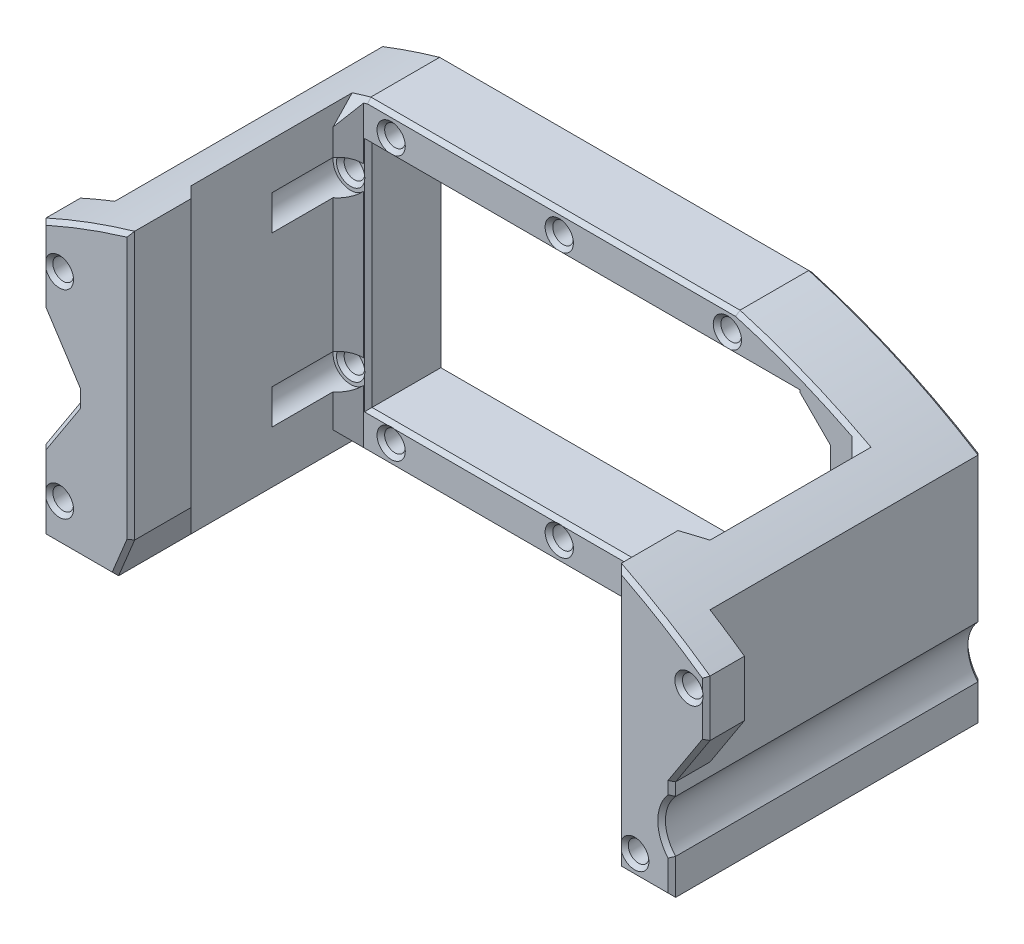
from build123d import *

# Parameters (mm, degrees)
SKETCH1_R                = 1.35
SKETCH1_W                = 56
SKETCH1_H                = 30
BOSS_EXTRUDE1_DEPTH      = 10
SKETCH2_W                = 5
SKETCH2_H                = 40.2
SKETCH2_H_2              = 35.1
BOSS_EXTRUDE2_DEPTH      = 27.57
BOSS_EXTRUDE3_DEPTH      = 3
BOSS_EXTRUDE3_DEPTH_BACK = 2
SKETCH3_R                = 1.35
SKETCH5_R                = 2.3
CUT_EXTRUDE2_DEPTH       = 10
CHAMFER4_SIZE            = 0.5
CUT_EXTRUDE3_DEPTH       = 40.57
CHAMFER6_SIZE            = 5
CHAMFER7_SIZE            = 4.545853152
CHAMFER7_SIZE_2          = 7
SKETCH7_R                = 5
CUT_EXTRUDE4_DEPTH       = 68.305088218
CHAMFER8_SIZE            = 4.545853152
CHAMFER8_SIZE_2          = 7
SKETCH9_R                = 2.35
CUT_EXTRUDE5_DEPTH       = 37.57
CHAMFER9_SIZE            = 0.5
CHAMFER10_SIZE           = 2
CUT_EXTRUDE6_DEPTH       = 6.825
CHAMFER11_SIZE           = 0.5


# Read off the part's stored shape, not the designer's step: Cut-Extrude3
with BuildPart() as part:
    # Sketch1 → Boss-Extrude1 (new body)
    with BuildSketch(Plane.XY):
        Polygon((33.5, 20.1), (45.3, 15), (45.3, -20.1), (-32.6, -20.1), (-32.6, 20.1), align=None)
        with Locations((22, 17.3)):
            Circle(SKETCH1_R, mode=Mode.SUBTRACT)
        with Locations((0, 17.3)):
            Circle(SKETCH1_R, mode=Mode.SUBTRACT)
        with Locations((-22, 17.3)):
            Circle(SKETCH1_R, mode=Mode.SUBTRACT)
        with Locations((-27.3, 11)):
            Circle(SKETCH1_R, mode=Mode.SUBTRACT)
        with Locations(Location((22, -17.3, 0), (0, 0, 180))):
            Circle(SKETCH1_R, mode=Mode.SUBTRACT)
        with Locations(Location((0, -17.3, 0), (0, 0, 180))):
            Circle(SKETCH1_R, mode=Mode.SUBTRACT)
        with Locations(Location((-22, -17.3, 0), (0, 0, 180))):
            Circle(SKETCH1_R, mode=Mode.SUBTRACT)
        with Locations(Location((-27.3, -11, 0), (0, 0, 180))):
            Circle(SKETCH1_R, mode=Mode.SUBTRACT)
        with Locations((3, 0)):
            Rectangle(SKETCH1_W, SKETCH1_H, mode=Mode.SUBTRACT)
    extrude(amount=BOSS_EXTRUDE1_DEPTH)

    # Sketch2 → Boss-Extrude2 (add)
    with BuildSketch(Plane.XY.offset(10)):
        with Locations((-30.1, 0)):
            Rectangle(SKETCH2_W, SKETCH2_H)
        with Locations((42.8, -2.55)):
            Rectangle(SKETCH2_W, SKETCH2_H_2)
    extrude(amount=BOSS_EXTRUDE2_DEPTH)

    # Sketch3 → Boss-Extrude3 (add, two sides: drawn at the far end of the back side and taken through both)
    # profile 1 of 2: a face of its own
    with BuildSketch(Plane.XY.offset(37.57).offset(-BOSS_EXTRUDE3_DEPTH_BACK)):
        Polygon((49.8, 0), (45.3, 0), (45.3, -20.1), (38.2, -20.1), (38.2, 15), (49.8, 15), align=None)
        with Locations((47.55, 5)):
            Circle(SKETCH3_R, mode=Mode.SUBTRACT)
        with Locations((40.45, -17.3)):
            Circle(SKETCH3_R, mode=Mode.SUBTRACT)
    # profile 2 of 2: a face of its own
    with BuildSketch(Plane.XY.offset(37.57).offset(-BOSS_EXTRUDE3_DEPTH_BACK)):
        Polygon((-25.5, 20.1), (-37.1, 20.1), (-37.1, 6), (-32.6, 6), (-32.6, -10), (-37.1, -10), (-37.1, -20.1), (-27.6, -20.1), (-25.5, -15), align=None)
        with Locations((-34.85, 11)):
            Circle(SKETCH3_R, mode=Mode.SUBTRACT)
        with Locations((-34.85, -15)):
            Circle(SKETCH3_R, mode=Mode.SUBTRACT)
    extrude(amount=BOSS_EXTRUDE3_DEPTH + BOSS_EXTRUDE3_DEPTH_BACK)

    # Sketch5 → Cut-Extrude2 (cut)
    with BuildSketch(Plane.XY.offset(10)):
        with Locations((-27.3, 11)):
            Circle(SKETCH5_R)
        with Locations((-27.3, -11)):
            Circle(SKETCH5_R)
    extrude(amount=CUT_EXTRUDE2_DEPTH, mode=Mode.SUBTRACT)

    # Chamfer4
    chamfer4_edges = [part.edges().sort_by_distance(p)[0] for p in [
        (42.8, 15, 10),
    ]]
    chamfer(chamfer4_edges, length=CHAMFER4_SIZE)

    # Cut-Extrude3 outline → Cut-Extrude3 (cut)
    with BuildSketch(Plane.XY):
        with BuildLine():
            Line((33.5, 20.1), (23.154502686, 20.1))
            ThreePointArc((23.154502686, 20.1), (37.024570378, 14.805977232), (49.8, 7.243315476))
            Line((49.8, 7.243315476), (49.8, 15))
            Line((49.8, 15), (45.3, 15))
            Line((45.3, 15), (33.5, 20.1))
        make_face()
        with BuildLine():
            ThreePointArc((-37.1, 15.705959627), (-31.207253619, 18.120471436), (-25.154502686, 20.1))
            Line((-25.154502686, 20.1), (-37.1, 20.1))
            Line((-37.1, 20.1), (-37.1, 15.705959627))
        make_face()
    extrude(amount=CUT_EXTRUDE3_DEPTH, mode=Mode.SUBTRACT)

    # Chamfer6
    # the kernel refuses this chamfer: 5 mm, written as the material it adds along each edge
    with BuildSketch(Plane(origin=(-27.6, 32.217217715, 35.57), x_dir=(-0.027495876610586317, 0, -0.9996219169112968), z_dir=(0, -1, 0))) as chamfer6_piece_1_section:
        Polygon((CHAMFER6_SIZE * 0.999621916911, CHAMFER6_SIZE * 0.0274958766106), (-CHAMFER6_SIZE * 0.0274958766106, CHAMFER6_SIZE * 0.999621916911), (0, 0), align=None)
    chamfer6_piece_1 = extrude(amount=52.317217715, mode=Mode.PRIVATE)
    chamfer6_piece_1 = chamfer6_piece_1 & Plane(origin=(-1.000000031, -63.999999922, 33.508943712), x_dir=(-0.4125714286119157, 0.9109252528572929, 0), z_dir=(0, 0, -1)) * Cylinder(87.499999916, 125, mode=Mode.PRIVATE)
    chamfer6_piece_1 = split(chamfer6_piece_1, bisect_by=Plane(origin=(-20.109291031, -1.908278217, 33.508943712), z_dir=(-0.9246780984747165, 0.38074980525429386, 0)), keep=Keep.TOP, mode=Mode.PRIVATE)
    chamfer6_piece_1 = split(chamfer6_piece_1, bisect_by=Plane(origin=(-25.5, 0.820013119, 33.508943712), z_dir=(-1, 0, 0)), keep=Keep.TOP, mode=Mode.PRIVATE)
    add(chamfer6_piece_1)
    with BuildSketch(Plane(origin=(40.3, -28.816774153, 35.57), x_dir=(0.027495876610586317, 0, -0.9996219169112968), z_dir=(0, 1, 0))) as chamfer6_piece_2_section:
        Polygon((CHAMFER6_SIZE * 0.999621916911, CHAMFER6_SIZE * 0.0274958766106), (-CHAMFER6_SIZE * 0.0274958766106, CHAMFER6_SIZE * 0.999621916911), (0, 0), align=None)
    chamfer6_piece_2 = extrude(amount=54.815062051, mode=Mode.PRIVATE)
    chamfer6_piece_2 = split(chamfer6_piece_2, bisect_by=Plane(origin=(39.385160208, -20.1, 33.537544361), z_dir=(0, 1, 0)), keep=Keep.TOP, mode=Mode.PRIVATE)
    chamfer6_piece_2 = chamfer6_piece_2 & Plane(origin=(-1.000000015, -64.000000032, 33.537544361), x_dir=(0.2760514593327394, 0.9611428571238851, 0), z_dir=(0, 0, -1)) * Cylinder(87.500000035, 130, mode=Mode.PRIVATE)
    chamfer6_piece_2 = chamfer6_piece_2 - Plane(origin=(40.45, -17.3, 33.537544361), x_dir=(1, 0, 0), z_dir=(0, 0, -1)) * Cylinder(1.35, 130, mode=Mode.PRIVATE)
    chamfer6_piece_2 = split(chamfer6_piece_2, bisect_by=Plane(origin=(38.2, -2.625807198, 33.537544361), z_dir=(1, 0, 0)), keep=Keep.TOP, mode=Mode.PRIVATE)
    add(chamfer6_piece_2)
    with BuildSketch(Plane(origin=(40.3, -20.1, 35.57), x_dir=(0.027495876610586317, 0, -0.9996219169112968), z_dir=(0, 1, 0))) as chamfer6_piece_3_section:
        Polygon((CHAMFER6_SIZE * 0.999621916911, CHAMFER6_SIZE * 0.0274958766106), (-CHAMFER6_SIZE * 0.0274958766106, CHAMFER6_SIZE * 0.999621916911), (0, 0), align=None)
    chamfer6_piece_3 = extrude(amount=14.316774153, mode=Mode.PRIVATE)
    chamfer6_piece_3 = chamfer6_piece_3 - Plane(origin=(40.45, -17.3, 33.551570137), x_dir=(1, 0, 0), z_dir=(0, 0, -1)) * Cylinder(1.35, 49, mode=Mode.PRIVATE)
    chamfer6_piece_3 = split(chamfer6_piece_3, bisect_by=Plane(origin=(38.2, -12.460180623, 33.551570137), z_dir=(1, 0, 0)), keep=Keep.TOP, mode=Mode.PRIVATE)
    add(chamfer6_piece_3)

    # Chamfer7
    # the kernel refuses this chamfer: 7, 4.545853152 mm, written as the material it adds along each edge
    with BuildSketch(Plane(origin=(45.3, 0, 35.57), x_dir=(0.9987532912567346, 0.049918565722988334, 0), z_dir=(0, 0, 1))) as chamfer7_piece_1_section:
        Polygon((CHAMFER7_SIZE * 0.998753291341, -CHAMFER7_SIZE * 0.0499185657272), (-CHAMFER7_SIZE_2 * 0.049918565723, -CHAMFER7_SIZE_2 * 0.998753291257), (0, 0), align=None)
    chamfer7_piece_1 = extrude(amount=5, mode=Mode.PRIVATE)
    chamfer7_piece_1 = split(chamfer7_piece_1, bisect_by=Plane(origin=(49.8, -2.345805882, 38.07), z_dir=(-1, 0, 0)), keep=Keep.TOP, mode=Mode.PRIVATE)
    add(chamfer7_piece_1)

    # Sketch7 → Cut-Extrude4 (cut, through all)
    with BuildSketch(Plane(origin=(0, 0, 0), x_dir=(-1, 0, 0), z_dir=(0, 0, -1))):
        with Locations((-48.97, -12.05)):
            Circle(SKETCH7_R)
    extrude(amount=-CUT_EXTRUDE4_DEPTH, mode=Mode.SUBTRACT)

    # Chamfer8
    # the kernel refuses this chamfer: 7, 4.545853152 mm, written as the material it adds along each edge
    with BuildSketch(Plane(origin=(-32.6, -10, 35.57), x_dir=(-0.9987532912567346, -0.04991856572298821, 0), z_dir=(0, 0, 1))) as chamfer8_piece_1_section:
        Polygon((CHAMFER8_SIZE * 0.998753291341, -CHAMFER8_SIZE * 0.0499185657272), (-CHAMFER8_SIZE_2 * 0.049918565723, -CHAMFER8_SIZE_2 * 0.998753291257), (0, 0), align=None)
    chamfer8_piece_1 = extrude(amount=5, mode=Mode.PRIVATE)
    chamfer8_piece_1 = split(chamfer8_piece_1, bisect_by=Plane(origin=(-37.1, -7.654194118, 38.07), z_dir=(1, 0, 0)), keep=Keep.TOP, mode=Mode.PRIVATE)
    add(chamfer8_piece_1)
    with BuildSketch(Plane(origin=(-32.6, 6, 40.57), x_dir=(-0.9987532912567346, 0.049918565722988396, 0), z_dir=(0, 0, -1))) as chamfer8_piece_2_section:
        Polygon((CHAMFER8_SIZE * 0.998753291341, -CHAMFER8_SIZE * 0.0499185657272), (-CHAMFER8_SIZE_2 * 0.049918565723, -CHAMFER8_SIZE_2 * 0.998753291257), (0, 0), align=None)
    chamfer8_piece_2 = extrude(amount=5, mode=Mode.PRIVATE)
    chamfer8_piece_2 = split(chamfer8_piece_2, bisect_by=Plane(origin=(-37.1, 3.654194118, 38.07), z_dir=(1, 0, 0)), keep=Keep.TOP, mode=Mode.PRIVATE)
    add(chamfer8_piece_2)

    # Sketch9 → Cut-Extrude5 (cut)
    with BuildSketch(Plane.XY):
        with Locations(Location((40.45, -17.3, 0), (0, 0, 196.774744264))):
            Circle(SKETCH9_R)
    extrude(amount=CUT_EXTRUDE5_DEPTH, mode=Mode.SUBTRACT)

    # Chamfer9
    # the kernel refuses this chamfer: 0.5 mm, written as the material it takes off along each edge
    with BuildSketch(Plane(origin=(-34.85, 11, 40.57), x_dir=(1, 0, 0), z_dir=(0, -1, 0))) as chamfer9_piece_1:
        Polygon((1.35, -CHAMFER9_SIZE), (1.35 + CHAMFER9_SIZE, 0), (1.35, 0), align=None)
    revolve(axis=Axis((-34.85, 11, 40.57), (0, 0, 1)), mode=Mode.SUBTRACT)
    with BuildSketch(Plane(origin=(-34.85, -15, 40.57), x_dir=(1, 0, 0), z_dir=(0, -1, 0))) as chamfer9_piece_2:
        Polygon((1.35, -CHAMFER9_SIZE), (1.35 + CHAMFER9_SIZE, 0), (1.35, 0), align=None)
    revolve(axis=Axis((-34.85, -15, 40.57), (0, 0, 1)), mode=Mode.SUBTRACT)
    with BuildSketch(Plane(origin=(-25.5, -16.285841494, 40.57), x_dir=(0.027495876610589196, 0, -0.9996219169112968), z_dir=(0, 1, 0))) as chamfer9_piece_3:
        Polygon((CHAMFER9_SIZE * 0.999621916911, CHAMFER9_SIZE * 0.0274958766106), (-CHAMFER9_SIZE * 0.0274958766106, CHAMFER9_SIZE * 0.999621916911), (0, 0), align=None)
    extrude(amount=37.571682988, mode=Mode.SUBTRACT)
    with BuildSketch(Plane(origin=(-37.1, -8.643550843, 40.57), x_dir=(-0.02749587661058229, 0, -0.9996219169112968), z_dir=(0, -1, 0))) as chamfer9_piece_4:
        Polygon((CHAMFER9_SIZE * 0.999621916911, CHAMFER9_SIZE * 0.0274958766106), (-CHAMFER9_SIZE * 0.0274958766106, CHAMFER9_SIZE * 0.999621916911), (0, 0), align=None)
    extrude(amount=12.742290651, mode=Mode.SUBTRACT)
    with BuildSketch(Plane(origin=(-38.385841494, -20.1, 40.57), x_dir=(0, -0.027495876610589196, -0.9996219169112968), z_dir=(1, 0, 0))) as chamfer9_piece_5:
        Polygon((CHAMFER9_SIZE * 0.999621916911, CHAMFER9_SIZE * 0.0274958766106), (-CHAMFER9_SIZE * 0.0274958766106, CHAMFER9_SIZE * 0.999621916911), (0, 0), align=None)
    extrude(amount=12.071682988, mode=Mode.SUBTRACT)
    with BuildSketch(Plane(origin=(-28.089583898, -21.288989468, 40.57), x_dir=(0.025424834900177554, -0.01046904966477896, -0.9996219169112965), z_dir=(0.38074980525429386, 0.9246780984747165, 0))) as chamfer9_piece_6:
        Polygon((CHAMFER9_SIZE * 0.999621916911, CHAMFER9_SIZE * 0.0274958766106), (-CHAMFER9_SIZE * 0.0274958766106, CHAMFER9_SIZE * 0.999621916911), (0, 0), align=None)
    extrude(amount=8.087115881, mode=Mode.SUBTRACT)
    with BuildSketch(Plane(origin=(47.55, 5, 35.57), x_dir=(1, 0, 0), z_dir=(0, -1, 0))) as chamfer9_piece_7:
        Polygon((1.35 + CHAMFER9_SIZE, 0), (1.35, CHAMFER9_SIZE), (1.35, 0), align=None)
    revolve(axis=Axis((47.55, 5, 35.57), (0, 0, 1)), mode=Mode.SUBTRACT)
    with BuildSketch(Plane(origin=(40.45, -17.3, 40.57), x_dir=(1, 0, 0), z_dir=(0, -1, 0))) as chamfer9_piece_8:
        Polygon((1.35, -CHAMFER9_SIZE), (1.35 + CHAMFER9_SIZE, 0), (1.35, 0), align=None)
    revolve(axis=Axis((40.45, -17.3, 40.57), (0, 0, 1)), mode=Mode.SUBTRACT)
    with BuildSketch(Plane(origin=(47.55, 5, 40.57), x_dir=(1, 0, 0), z_dir=(0, -1, 0))) as chamfer9_piece_9:
        Polygon((1.35, -CHAMFER9_SIZE), (1.35 + CHAMFER9_SIZE, 0), (1.35, 0), align=None)
    revolve(axis=Axis((47.55, 5, 40.57), (0, 0, 1)), mode=Mode.SUBTRACT)
    with BuildSketch(Plane(origin=(46.585841494, -20.1, 40.57), x_dir=(0, -0.027495876610589196, -0.9996219169112968), z_dir=(-1, 0, 0))) as chamfer9_piece_10:
        Polygon((CHAMFER9_SIZE * 0.999621916911, -CHAMFER9_SIZE * 0.0274958766106), (-CHAMFER9_SIZE * 0.0274958766106, -CHAMFER9_SIZE * 0.999621916911), (0, 0), align=None)
    extrude(amount=9.671682988, mode=Mode.SUBTRACT)
    with BuildSketch(Plane(origin=(45.3, -14.159905846, 40.57), x_dir=(0.02749587661058229, 0, -0.9996219169112968), z_dir=(0, -1, 0))) as chamfer9_piece_11:
        Polygon((CHAMFER9_SIZE * 0.999621916911, -CHAMFER9_SIZE * 0.0274958766106), (-CHAMFER9_SIZE * 0.0274958766106, -CHAMFER9_SIZE * 0.999621916911), (0, 0), align=None)
    extrude(amount=7.225935648, mode=Mode.SUBTRACT)
    with BuildSketch(Plane(origin=(49.8, -1.356449157, 40.57), x_dir=(0.02749587661058229, 0, -0.9996219169112968), z_dir=(0, 1, 0))) as chamfer9_piece_12:
        Polygon((CHAMFER9_SIZE * 0.999621916911, CHAMFER9_SIZE * 0.0274958766106), (-CHAMFER9_SIZE * 0.0274958766106, CHAMFER9_SIZE * 0.999621916911), (0, 0), align=None)
    extrude(amount=9.885606127, mode=Mode.SUBTRACT)
    with BuildSketch(Plane(origin=(-25, -15, 0), x_dir=(0, -0.9996219169112968, -0.02749587661058639), z_dir=(1, 0, 0)), Plane(origin=(31, 15, 0), x_dir=(0, 0.9996219169112968, -0.02749587661058639), z_dir=(-1, 0, 0)), Plane(origin=(-25, -15, 10), x_dir=(0, 0.027495876610585647, -0.9996219169112968), z_dir=(1, 0, 0)), Plane(origin=(31, 15, 10), x_dir=(0, -0.027495876610585647, -0.9996219169112968), z_dir=(-1, 0, 0))) as chamfer9_piece_13:
        Polygon((CHAMFER9_SIZE * 0.999621916911, -CHAMFER9_SIZE * 0.0274958766106), (-CHAMFER9_SIZE * 0.0274958766106, -CHAMFER9_SIZE * 0.999621916911), (0, 0), align=None)
    extrude(amount=56, mode=Mode.SUBTRACT)
    with BuildSketch(Plane(origin=(31, -15, 0), x_dir=(0.9996219169112968, 0, -0.027495876610586008), z_dir=(0, 1, 0)), Plane(origin=(-25, 15, 0), x_dir=(-0.9996219169112968, 0, -0.027495876610586292), z_dir=(0, -1, 0)), Plane(origin=(31, -15, 10), x_dir=(-0.0274958766105891, 0, -0.9996219169112968), z_dir=(0, 1, 0))) as chamfer9_piece_14:
        Polygon((CHAMFER9_SIZE * 0.999621916911, -CHAMFER9_SIZE * 0.0274958766106), (-CHAMFER9_SIZE * 0.0274958766106, -CHAMFER9_SIZE * 0.999621916911), (0, 0), align=None)
    extrude(amount=30, mode=Mode.SUBTRACT)
    with BuildSketch(Plane(origin=(-25, -15, 10), x_dir=(0.0274958766105891, 0, -0.9996219169112968), z_dir=(0, 1, 0))) as chamfer9_piece_15:
        Polygon((CHAMFER9_SIZE * 0.999621916911, CHAMFER9_SIZE * 0.0274958766106), (-CHAMFER9_SIZE * 0.0274958766106, CHAMFER9_SIZE * 0.999621916911), (0, 0), align=None)
    extrude(amount=30, mode=Mode.SUBTRACT)
    with BuildSketch(Plane(origin=(38.2, -21.385841494, 40.57), x_dir=(0.999621916911297, 0, 0.027495876610581914), z_dir=(0, 1, 0))) as chamfer9_piece_16:
        Polygon((CHAMFER9_SIZE * 0.999621916911, CHAMFER9_SIZE * 0.0274958766106), (-CHAMFER9_SIZE * 0.0274958766106, CHAMFER9_SIZE * 0.999621916911), (0, 0), align=None)
    extrude(amount=36.899619174, mode=Mode.SUBTRACT)
    with BuildSketch(Plane(origin=(-37.1, 16.991801121, 40.57), x_dir=(-0.02749587661058229, 0, -0.9996219169112968), z_dir=(0, -1, 0))) as chamfer9_piece_17:
        Polygon((CHAMFER9_SIZE * 0.999621916911, CHAMFER9_SIZE * 0.0274958766106), (-CHAMFER9_SIZE * 0.0274958766106, CHAMFER9_SIZE * 0.999621916911), (0, 0), align=None)
    extrude(amount=12.348250278, mode=Mode.SUBTRACT)
    with BuildSketch(Plane(origin=(-26.44034418, 20.1, 10), x_dir=(0, 0.0274958766105891, -0.9996219169112968), z_dir=(1, 0, 0)), Plane(origin=(-26.44034418, 20.1, 0), x_dir=(0, -0.9996219169112968, -0.027495876610586292), z_dir=(1, 0, 0))) as chamfer9_piece_18:
        Polygon((CHAMFER9_SIZE * 0.999621916911, -CHAMFER9_SIZE * 0.0274958766106), (-CHAMFER9_SIZE * 0.0274958766106, -CHAMFER9_SIZE * 0.999621916911), (0, 0), align=None)
    extrude(amount=50.88068836, mode=Mode.SUBTRACT)
    with BuildSketch(Plane(origin=(-32.6, -21.385841494, 0), x_dir=(0.9996219169112968, 0, -0.027495876610586483), z_dir=(0, 1, 0))) as chamfer9_piece_19:
        Polygon((CHAMFER9_SIZE * 0.999621916911, -CHAMFER9_SIZE * 0.0274958766106), (-CHAMFER9_SIZE * 0.0274958766106, -CHAMFER9_SIZE * 0.999621916911), (0, 0), align=None)
    extrude(amount=40.266351932, mode=Mode.SUBTRACT)
    with BuildSketch(Plane(origin=(-1.000000015, -64.000000032, 0), x_dir=(0.26189767014704823, 0.9650956483020467, 0), z_dir=(-0.9650956483020467, 0.26189767014704823, 0))) as chamfer9_piece_20:
        Polygon((87.500000035, -CHAMFER9_SIZE), (87.500000035 - CHAMFER9_SIZE, 0), (87.500000035, 0), align=None)
    revolve(axis=Axis((-1.000000015, -64.000000032, 0), (0, 0, -1)), revolution_arc=17.606857442, mode=Mode.SUBTRACT)
    with BuildSketch(Plane(origin=(-1.000000031, -63.999999922, 0), x_dir=(-0.37480693844731544, 0.9271028847392022, 0), z_dir=(-0.9271028847392022, -0.37480693844731544, 0))) as chamfer9_piece_21:
        Polygon((87.499999916, -CHAMFER9_SIZE), (87.499999916 - CHAMFER9_SIZE, 0), (87.499999916, 0), align=None)
    revolve(axis=Axis((-1.000000031, -63.999999922, 0), (0, 0, -1)), revolution_arc=6.829678471, mode=Mode.SUBTRACT)
    with BuildSketch(Plane(origin=(-1.000000031, -63.999999922, 40.57), x_dir=(-0.4259127914102548, 0.9047642201773481, 0), z_dir=(-0.9047642201773481, -0.4259127914102548, 0))) as chamfer9_piece_22:
        Polygon((87.499999916, CHAMFER9_SIZE), (87.499999916 - CHAMFER9_SIZE, 0), (87.499999916, 0), align=None)
    revolve(axis=Axis((-1.000000031, -63.999999922, 40.57), (0, 0, -1)), revolution_arc=9.790232324, mode=Mode.SUBTRACT)
    with BuildSketch(Plane(origin=(-1.000000015, -64.000000032, 10), x_dir=(0.2618977448025203, 0.9650956280428142, 0), z_dir=(-0.9650956280428142, 0.2618977448025203, 0))) as chamfer9_piece_23_section:
        Polygon((87.500000035, CHAMFER9_SIZE), (87.500000035 - CHAMFER9_SIZE, 0), (87.500000035, 0), align=None)
    chamfer9_piece_23 = revolve(axis=Axis((-1.000000015, -64.000000032, 10), (0, 0, -1)), revolution_arc=13.823488534, mode=Mode.PRIVATE)
    chamfer9_piece_23 = split(chamfer9_piece_23, bisect_by=Plane(origin=(40.3, 17.039811095, 9.759887498), z_dir=(-1, 0, 0)), keep=Keep.TOP, mode=Mode.PRIVATE)
    add(chamfer9_piece_23, mode=Mode.SUBTRACT)
    with BuildSketch(Plane(origin=(-1.000000031, -63.999999922, 10), x_dir=(-0.31796650495992856, 0.9481019469042177, 0), z_dir=(-0.9481019469042177, -0.31796650495992856, 0))) as chamfer9_piece_24_section:
        Polygon((87.499999916, CHAMFER9_SIZE), (87.499999916 - CHAMFER9_SIZE, 0), (87.499999916, 0), align=None)
    chamfer9_piece_24 = revolve(axis=Axis((-1.000000031, -63.999999922, 10), (0, 0, -1)), revolution_arc=3.357288735, mode=Mode.PRIVATE)
    chamfer9_piece_24 = split(chamfer9_piece_24, bisect_by=Plane(origin=(-27.6, 19.748899544, 9.835704297), z_dir=(1, 0, 0)), keep=Keep.TOP, mode=Mode.PRIVATE)
    add(chamfer9_piece_24, mode=Mode.SUBTRACT)
    with BuildSketch(Plane(origin=(-1.000000015, -64.000000032, 40.57), x_dir=(0.4348139292755294, 0.9005203200972064, 0), z_dir=(-0.9005203200972064, 0.4348139292755294, 0))) as chamfer9_piece_25:
        Polygon((87.500000035, CHAMFER9_SIZE), (87.500000035 - CHAMFER9_SIZE, 0), (87.500000035, 0), align=None)
    revolve(axis=Axis((-1.000000015, -64.000000032, 40.57), (0, 0, -1)), revolution_arc=10.559273171, mode=Mode.SUBTRACT)
    with BuildSketch(Plane(origin=(22, 17.3, 0), x_dir=(1, 0, 0), z_dir=(0, -1, 0))) as chamfer9_piece_26:
        Polygon((1.35 + CHAMFER9_SIZE, 0), (1.35, CHAMFER9_SIZE), (1.35, 0), align=None)
    revolve(axis=Axis((22, 17.3, 0), (0, 0, 1)), mode=Mode.SUBTRACT)
    with BuildSketch(Plane(origin=(22, 17.3, 10), x_dir=(1, 0, 0), z_dir=(0, -1, 0))) as chamfer9_piece_27:
        Polygon((1.35, -CHAMFER9_SIZE), (1.35 + CHAMFER9_SIZE, 0), (1.35, 0), align=None)
    revolve(axis=Axis((22, 17.3, 10), (0, 0, 1)), mode=Mode.SUBTRACT)
    with BuildSketch(Plane(origin=(50.50031947, 1.007789753, 40.57), x_dir=(0.023059982453161276, -0.0149753277040835, -0.9996219169112965), z_dir=(-0.5446390350150069, -0.8386705679454372, 0))) as chamfer9_piece_28_section:
        Polygon((CHAMFER9_SIZE * 0.999621916911, -CHAMFER9_SIZE * 0.0274958766106), (-CHAMFER9_SIZE * 0.0274958766106, -CHAMFER9_SIZE * 0.999621916911), (0, 0), align=None)
    chamfer9_piece_28 = extrude(amount=10.834036052, mode=Mode.PRIVATE)
    chamfer9_piece_28 = split(chamfer9_piece_28, bisect_by=Plane(origin=(45.3, -2.802949709, 40.40369704), z_dir=(1, 0, 0)), keep=Keep.TOP, mode=Mode.PRIVATE)
    add(chamfer9_piece_28, mode=Mode.SUBTRACT)
    with BuildSketch(Plane(origin=(45.3, -5.714158506, 40.57), x_dir=(0.02749587661058229, 0, -0.9996219169112968), z_dir=(0, -1, 0))) as chamfer9_piece_29_section:
        Polygon((CHAMFER9_SIZE * 0.999621916911, -CHAMFER9_SIZE * 0.0274958766106), (-CHAMFER9_SIZE * 0.0274958766106, -CHAMFER9_SIZE * 0.999621916911), (0, 0), align=None)
    chamfer9_piece_29 = extrude(amount=4.225935648, mode=Mode.PRIVATE)
    chamfer9_piece_29 = split(chamfer9_piece_29, bisect_by=Plane(origin=(44.52751756, -8.189518645, 40.400237862), z_dir=(0.8386705679454372, -0.5446390350150069, 0)), keep=Keep.TOP, mode=Mode.PRIVATE)
    add(chamfer9_piece_29, mode=Mode.SUBTRACT)
    with BuildSketch(Plane(origin=(45.3, 11.532457578, 0), x_dir=(0.027495876610582174, 0, 0.9996219169112968), z_dir=(0, -1, 0))) as chamfer9_piece_30:
        Polygon((CHAMFER9_SIZE * 0.999621916911, CHAMFER9_SIZE * 0.0274958766106), (-CHAMFER9_SIZE * 0.0274958766106, CHAMFER9_SIZE * 0.999621916911), (0, 0), align=None)
    extrude(amount=21.472551732, mode=Mode.SUBTRACT)
    with BuildSketch(Plane(origin=(48.97, -12.05, 40.57), x_dir=(-0.5370460782909577, -0.8435529087095265, 0), z_dir=(0.8435529087095265, -0.5370460782909577, 0))) as chamfer9_piece_31:
        Polygon((5, CHAMFER9_SIZE), (5 + CHAMFER9_SIZE, 0), (5, 0), align=None)
    revolve(axis=Axis((48.97, -12.05, 40.57), (0, 0, -1)), revolution_arc=115.03444382, mode=Mode.SUBTRACT)
    with BuildSketch(Plane(origin=(48.97, -12.05, 0), x_dir=(-0.5370460782909677, 0.84355290870952, 0), z_dir=(0.84355290870952, 0.5370460782909677, 0))) as chamfer9_piece_32:
        Polygon((5, CHAMFER9_SIZE), (5 + CHAMFER9_SIZE, 0), (5, 0), align=None)
    revolve(axis=Axis((48.97, -12.05, 0), (0, 0, 1)), revolution_arc=115.03444382, mode=Mode.SUBTRACT)
    with BuildSketch(Plane(origin=(-32.6, 0.285841494, 40.57), x_dir=(-0.02749587661058229, 0, -0.9996219169112968), z_dir=(0, -1, 0))) as chamfer9_piece_33_section:
        Polygon((CHAMFER9_SIZE * 0.999621916911, CHAMFER9_SIZE * 0.0274958766106), (-CHAMFER9_SIZE * 0.0274958766106, CHAMFER9_SIZE * 0.999621916911), (0, 0), align=None)
    chamfer9_piece_33 = extrude(amount=4.571682988, mode=Mode.PRIVATE)
    chamfer9_piece_33 = split(chamfer9_piece_33, bisect_by=Plane(origin=(-32.104033181, -1.763721927, 40.38758617), z_dir=(-0.8386705679454372, -0.5446390350150069, 0)), keep=Keep.TOP, mode=Mode.PRIVATE)
    chamfer9_piece_33 = split(chamfer9_piece_33, bisect_by=Plane(origin=(-32.104033181, -2.236278073, 40.38758617), z_dir=(-0.8386705679454372, 0.5446390350150069, 0)), keep=Keep.TOP, mode=Mode.PRIVATE)
    add(chamfer9_piece_33, mode=Mode.SUBTRACT)
    with BuildSketch(Plane(origin=(-37.80031947, -11.007789753, 40.57), x_dir=(-0.023059982453162067, 0.014975327704084013, -0.9996219169112965), z_dir=(0.5446390350150069, 0.8386705679454372, 0))) as chamfer9_piece_34_section:
        Polygon((CHAMFER9_SIZE * 0.999621916911, -CHAMFER9_SIZE * 0.0274958766106), (-CHAMFER9_SIZE * 0.0274958766106, -CHAMFER9_SIZE * 0.999621916911), (0, 0), align=None)
    chamfer9_piece_34 = extrude(amount=10.834036052, mode=Mode.PRIVATE)
    chamfer9_piece_34 = split(chamfer9_piece_34, bisect_by=Plane(origin=(-32.6, -7.197050291, 40.40369704), z_dir=(-1, 0, 0)), keep=Keep.TOP, mode=Mode.PRIVATE)
    add(chamfer9_piece_34, mode=Mode.SUBTRACT)
    with BuildSketch(Plane(origin=(0, 17.3, 0), x_dir=(1, 0, 0), z_dir=(0, -1, 0))) as chamfer9_piece_35:
        Polygon((1.35 + CHAMFER9_SIZE, 0), (1.35, CHAMFER9_SIZE), (1.35, 0), align=None)
    revolve(axis=Axis((0, 17.3, 0), (0, 0, 1)), mode=Mode.SUBTRACT)
    with BuildSketch(Plane(origin=(-37.80031947, 7.007789753, 40.57), x_dir=(-0.023059982453162854, -0.014975327704084525, -0.9996219169112965), z_dir=(0.5446390350150069, -0.8386705679454372, 0))) as chamfer9_piece_36_section:
        Polygon((CHAMFER9_SIZE * 0.999621916911, CHAMFER9_SIZE * 0.0274958766106), (-CHAMFER9_SIZE * 0.0274958766106, CHAMFER9_SIZE * 0.999621916911), (0, 0), align=None)
    chamfer9_piece_36 = extrude(amount=10.834036052, mode=Mode.PRIVATE)
    chamfer9_piece_36 = split(chamfer9_piece_36, bisect_by=Plane(origin=(-32.6, 3.197050291, 40.40369704), z_dir=(-1, 0, 0)), keep=Keep.TOP, mode=Mode.PRIVATE)
    add(chamfer9_piece_36, mode=Mode.SUBTRACT)
    with BuildSketch(Plane(origin=(0, 17.3, 10), x_dir=(1, 0, 0), z_dir=(0, -1, 0))) as chamfer9_piece_37:
        Polygon((1.35, -CHAMFER9_SIZE), (1.35 + CHAMFER9_SIZE, 0), (1.35, 0), align=None)
    revolve(axis=Axis((0, 17.3, 10), (0, 0, 1)), mode=Mode.SUBTRACT)
    with BuildSketch(Plane(origin=(40.45, -17.3, 0), x_dir=(-0.957446808511119, -0.2886097865143741, 0), z_dir=(-0.2886097865143741, 0.957446808511119, 0))) as chamfer9_piece_38:
        Polygon((2.35, CHAMFER9_SIZE), (2.35 + CHAMFER9_SIZE, 0), (2.35, 0), align=None)
    revolve(axis=Axis((40.45, -17.3, 0), (0, 0, 1)), mode=Mode.SUBTRACT)
    with BuildSketch(Plane(origin=(-22, 17.3, 0), x_dir=(1, 0, 0), z_dir=(0, -1, 0))) as chamfer9_piece_39:
        Polygon((1.35 + CHAMFER9_SIZE, 0), (1.35, CHAMFER9_SIZE), (1.35, 0), align=None)
    revolve(axis=Axis((-22, 17.3, 0), (0, 0, 1)), mode=Mode.SUBTRACT)
    with BuildSketch(Plane(origin=(-22, 17.3, 10), x_dir=(1, 0, 0), z_dir=(0, -1, 0))) as chamfer9_piece_40:
        Polygon((1.35, -CHAMFER9_SIZE), (1.35 + CHAMFER9_SIZE, 0), (1.35, 0), align=None)
    revolve(axis=Axis((-22, 17.3, 10), (0, 0, 1)), mode=Mode.SUBTRACT)
    with BuildSketch(Plane(origin=(-27.3, 11, 0), x_dir=(1, 0, 0), z_dir=(0, -1, 0))) as chamfer9_piece_41:
        Polygon((1.35 + CHAMFER9_SIZE, 0), (1.35, CHAMFER9_SIZE), (1.35, 0), align=None)
    revolve(axis=Axis((-27.3, 11, 0), (0, 0, 1)), mode=Mode.SUBTRACT)
    with BuildSketch(Plane(origin=(-27.3, 11, 10), x_dir=(1, 0, 0), z_dir=(0, 1, 0))) as chamfer9_piece_42:
        Polygon((1.35, CHAMFER9_SIZE), (1.35 + CHAMFER9_SIZE, 0), (1.35, 0), align=None)
    revolve(axis=Axis((-27.3, 11, 10), (0, 0, -1)), mode=Mode.SUBTRACT)
    with BuildSketch(Plane(origin=(22, -17.3, 0), x_dir=(-1, 0, 0), z_dir=(0, 1, 0))) as chamfer9_piece_43:
        Polygon((1.35 + CHAMFER9_SIZE, 0), (1.35, CHAMFER9_SIZE), (1.35, 0), align=None)
    revolve(axis=Axis((22, -17.3, 0), (0, 0, 1)), mode=Mode.SUBTRACT)
    with BuildSketch(Plane(origin=(22, -17.3, 10), x_dir=(-1, 0, 0), z_dir=(0, 1, 0))) as chamfer9_piece_44:
        Polygon((1.35, -CHAMFER9_SIZE), (1.35 + CHAMFER9_SIZE, 0), (1.35, 0), align=None)
    revolve(axis=Axis((22, -17.3, 10), (0, 0, 1)), mode=Mode.SUBTRACT)
    with BuildSketch(Plane(origin=(0, -17.3, 0), x_dir=(-1, 0, 0), z_dir=(0, 1, 0))) as chamfer9_piece_45:
        Polygon((1.35 + CHAMFER9_SIZE, 0), (1.35, CHAMFER9_SIZE), (1.35, 0), align=None)
    revolve(axis=Axis((0, -17.3, 0), (0, 0, 1)), mode=Mode.SUBTRACT)
    with BuildSketch(Plane(origin=(0, -17.3, 10), x_dir=(-1, 0, 0), z_dir=(0, 1, 0))) as chamfer9_piece_46:
        Polygon((1.35, -CHAMFER9_SIZE), (1.35 + CHAMFER9_SIZE, 0), (1.35, 0), align=None)
    revolve(axis=Axis((0, -17.3, 10), (0, 0, 1)), mode=Mode.SUBTRACT)
    with BuildSketch(Plane(origin=(-22, -17.3, 0), x_dir=(-1, 0, 0), z_dir=(0, 1, 0))) as chamfer9_piece_47:
        Polygon((1.35 + CHAMFER9_SIZE, 0), (1.35, CHAMFER9_SIZE), (1.35, 0), align=None)
    revolve(axis=Axis((-22, -17.3, 0), (0, 0, 1)), mode=Mode.SUBTRACT)
    with BuildSketch(Plane(origin=(-22, -17.3, 10), x_dir=(-1, 0, 0), z_dir=(0, 1, 0))) as chamfer9_piece_48:
        Polygon((1.35, -CHAMFER9_SIZE), (1.35 + CHAMFER9_SIZE, 0), (1.35, 0), align=None)
    revolve(axis=Axis((-22, -17.3, 10), (0, 0, 1)), mode=Mode.SUBTRACT)
    with BuildSketch(Plane(origin=(-27.3, -11, 0), x_dir=(-1, 0, 0), z_dir=(0, 1, 0))) as chamfer9_piece_49:
        Polygon((1.35 + CHAMFER9_SIZE, 0), (1.35, CHAMFER9_SIZE), (1.35, 0), align=None)
    revolve(axis=Axis((-27.3, -11, 0), (0, 0, 1)), mode=Mode.SUBTRACT)
    with BuildSketch(Plane(origin=(-27.3, -11, 10), x_dir=(-1, 0, 0), z_dir=(0, -1, 0))) as chamfer9_piece_50:
        Polygon((1.35, CHAMFER9_SIZE), (1.35 + CHAMFER9_SIZE, 0), (1.35, 0), align=None)
    revolve(axis=Axis((-27.3, -11, 10), (0, 0, -1)), mode=Mode.SUBTRACT)
    with BuildSketch(Plane(origin=(45.3, -14.159905846, 0), x_dir=(0.027495876610582174, 0, 0.9996219169112968), z_dir=(0, -1, 0))) as chamfer9_piece_51:
        Polygon((CHAMFER9_SIZE * 0.999621916911, CHAMFER9_SIZE * 0.0274958766106), (-CHAMFER9_SIZE * 0.0274958766106, CHAMFER9_SIZE * 0.999621916911), (0, 0), align=None)
    extrude(amount=7.225935648, mode=Mode.SUBTRACT)
    with BuildSketch(Plane(origin=(46.585841494, -20.1, 0), x_dir=(0, -0.02749587661058908, 0.9996219169112968), z_dir=(-1, 0, 0))) as chamfer9_piece_52:
        Polygon((CHAMFER9_SIZE * 0.999621916911, CHAMFER9_SIZE * 0.0274958766106), (-CHAMFER9_SIZE * 0.0274958766106, CHAMFER9_SIZE * 0.999621916911), (0, 0), align=None)
    extrude(amount=80.471682988, mode=Mode.SUBTRACT)
    with BuildSketch(Plane(origin=(40.3, -20.1, 10), x_dir=(0, -0.027495876610602904, -0.9996219169112963), z_dir=(-1, 0, 0))) as chamfer9_piece_53:
        Polygon((CHAMFER9_SIZE * 0.999621916911, -CHAMFER9_SIZE * 0.0274958766106), (-CHAMFER9_SIZE * 0.0274958766106, -CHAMFER9_SIZE * 0.999621916911), (0, 0), align=None)
    extrude(amount=67.9, mode=Mode.SUBTRACT)
    with BuildSketch(Plane(origin=(-34.85, -15, 35.57), x_dir=(1, 0, 0), z_dir=(0, -1, 0))) as chamfer9_piece_54:
        Polygon((1.35 + CHAMFER9_SIZE, 0), (1.35, CHAMFER9_SIZE), (1.35, 0), align=None)
    revolve(axis=Axis((-34.85, -15, 35.57), (0, 0, 1)), mode=Mode.SUBTRACT)
    with BuildSketch(Plane(origin=(-34.85, 11, 35.57), x_dir=(1, 0, 0), z_dir=(0, -1, 0))) as chamfer9_piece_55:
        Polygon((1.35 + CHAMFER9_SIZE, 0), (1.35, CHAMFER9_SIZE), (1.35, 0), align=None)
    revolve(axis=Axis((-34.85, 11, 35.57), (0, 0, 1)), mode=Mode.SUBTRACT)
    with BuildSketch(Plane(origin=(-25, 15, 0), x_dir=(-0.9996219169112968, 0, -0.027495876610586292), z_dir=(0, -1, 0))) as chamfer9_piece_56a_section:
        Polygon((CHAMFER9_SIZE * 0.999621916911, -CHAMFER9_SIZE * 0.0274958766106), (-CHAMFER9_SIZE * 0.0274958766106, -CHAMFER9_SIZE * 0.999621916911), (0, 0), align=None)
    chamfer9_piece_56a = extrude(amount=31.285841494, mode=Mode.PRIVATE)
    chamfer9_piece_56a = split(chamfer9_piece_56a, bisect_by=Plane(origin=(-25.164896813, -15, 0.164896813), z_dir=(0, -1, 0)), keep=Keep.TOP, mode=Mode.PRIVATE)
    with BuildSketch(Plane(origin=(-26.285841494, -15, 0), x_dir=(0, -0.9996219169112968, -0.02749587661058639), z_dir=(1, 0, 0))) as chamfer9_piece_56b_section:
        Polygon((CHAMFER9_SIZE * 0.999621916911, -CHAMFER9_SIZE * 0.0274958766106), (-CHAMFER9_SIZE * 0.0274958766106, -CHAMFER9_SIZE * 0.999621916911), (0, 0), align=None)
    chamfer9_piece_56b = extrude(amount=57.285841494, mode=Mode.PRIVATE)
    chamfer9_piece_56b = split(chamfer9_piece_56b, bisect_by=Plane(origin=(-25, -15.164896813, 0.164896813), z_dir=(-1, 0, 0)), keep=Keep.TOP, mode=Mode.PRIVATE)
    chamfer9_piece_56 = chamfer9_piece_56a & chamfer9_piece_56b
    add(chamfer9_piece_56, mode=Mode.SUBTRACT)
    with BuildSketch(Plane(origin=(31, -16.285841494, 0), x_dir=(0.9996219169112968, 0, -0.0274958766105862), z_dir=(0, 1, 0))) as chamfer9_piece_57a_section:
        Polygon((CHAMFER9_SIZE * 0.999621916911, -CHAMFER9_SIZE * 0.0274958766106), (-CHAMFER9_SIZE * 0.0274958766106, -CHAMFER9_SIZE * 0.999621916911), (0, 0), align=None)
    chamfer9_piece_57a = extrude(amount=31.285841494, mode=Mode.PRIVATE)
    chamfer9_piece_57a = split(chamfer9_piece_57a, bisect_by=Plane(origin=(31.164896813, -15, 0.164896813), z_dir=(0, -1, 0)), keep=Keep.TOP, mode=Mode.PRIVATE)
    with BuildSketch(Plane(origin=(-25, -15, 0), x_dir=(0, -0.9996219169112968, -0.02749587661058639), z_dir=(1, 0, 0))) as chamfer9_piece_57b_section:
        Polygon((CHAMFER9_SIZE * 0.999621916911, -CHAMFER9_SIZE * 0.0274958766106), (-CHAMFER9_SIZE * 0.0274958766106, -CHAMFER9_SIZE * 0.999621916911), (0, 0), align=None)
    chamfer9_piece_57b = extrude(amount=57.285841494, mode=Mode.PRIVATE)
    chamfer9_piece_57b = split(chamfer9_piece_57b, bisect_by=Plane(origin=(31, -15.164896813, 0.164896813), z_dir=(1, 0, 0)), keep=Keep.TOP, mode=Mode.PRIVATE)
    chamfer9_piece_57 = chamfer9_piece_57a & chamfer9_piece_57b
    add(chamfer9_piece_57, mode=Mode.SUBTRACT)
    with BuildSketch(Plane(origin=(32.285841494, 15, 0), x_dir=(0, 0.9996219169112968, -0.02749587661058639), z_dir=(-1, 0, 0))) as chamfer9_piece_58a_section:
        Polygon((CHAMFER9_SIZE * 0.999621916911, -CHAMFER9_SIZE * 0.0274958766106), (-CHAMFER9_SIZE * 0.0274958766106, -CHAMFER9_SIZE * 0.999621916911), (0, 0), align=None)
    chamfer9_piece_58a = extrude(amount=57.285841494, mode=Mode.PRIVATE)
    chamfer9_piece_58a = split(chamfer9_piece_58a, bisect_by=Plane(origin=(31, 15.164896813, 0.164896813), z_dir=(1, 0, 0)), keep=Keep.TOP, mode=Mode.PRIVATE)
    with BuildSketch(Plane(origin=(31, -15, 0), x_dir=(0.9996219169112968, 0, -0.027495876610586008), z_dir=(0, 1, 0))) as chamfer9_piece_58b_section:
        Polygon((CHAMFER9_SIZE * 0.999621916911, -CHAMFER9_SIZE * 0.0274958766106), (-CHAMFER9_SIZE * 0.0274958766106, -CHAMFER9_SIZE * 0.999621916911), (0, 0), align=None)
    chamfer9_piece_58b = extrude(amount=31.285841494, mode=Mode.PRIVATE)
    chamfer9_piece_58b = split(chamfer9_piece_58b, bisect_by=Plane(origin=(31.164896813, 15, 0.164896813), z_dir=(0, 1, 0)), keep=Keep.TOP, mode=Mode.PRIVATE)
    chamfer9_piece_58 = chamfer9_piece_58a & chamfer9_piece_58b
    add(chamfer9_piece_58, mode=Mode.SUBTRACT)
    with BuildSketch(Plane(origin=(31, 15, 0), x_dir=(0, 0.9996219169112968, -0.02749587661058639), z_dir=(-1, 0, 0))) as chamfer9_piece_59a_section:
        Polygon((CHAMFER9_SIZE * 0.999621916911, -CHAMFER9_SIZE * 0.0274958766106), (-CHAMFER9_SIZE * 0.0274958766106, -CHAMFER9_SIZE * 0.999621916911), (0, 0), align=None)
    chamfer9_piece_59a = extrude(amount=57.285841494, mode=Mode.PRIVATE)
    chamfer9_piece_59a = split(chamfer9_piece_59a, bisect_by=Plane(origin=(-25, 15.164896813, 0.164896813), z_dir=(-1, 0, 0)), keep=Keep.TOP, mode=Mode.PRIVATE)
    with BuildSketch(Plane(origin=(-25, 16.285841494, 0), x_dir=(-0.9996219169112968, 0, -0.027495876610586292), z_dir=(0, -1, 0))) as chamfer9_piece_59b_section:
        Polygon((CHAMFER9_SIZE * 0.999621916911, -CHAMFER9_SIZE * 0.0274958766106), (-CHAMFER9_SIZE * 0.0274958766106, -CHAMFER9_SIZE * 0.999621916911), (0, 0), align=None)
    chamfer9_piece_59b = extrude(amount=31.285841494, mode=Mode.PRIVATE)
    chamfer9_piece_59b = split(chamfer9_piece_59b, bisect_by=Plane(origin=(-25.164896813, 15, 0.164896813), z_dir=(0, 1, 0)), keep=Keep.TOP, mode=Mode.PRIVATE)
    chamfer9_piece_59 = chamfer9_piece_59a & chamfer9_piece_59b
    add(chamfer9_piece_59, mode=Mode.SUBTRACT)
    with BuildSketch(Plane(origin=(-26.285841494, -15, 10), x_dir=(0, 0.027495876610585647, -0.9996219169112968), z_dir=(1, 0, 0))) as chamfer9_piece_60a_section:
        Polygon((CHAMFER9_SIZE * 0.999621916911, -CHAMFER9_SIZE * 0.0274958766106), (-CHAMFER9_SIZE * 0.0274958766106, -CHAMFER9_SIZE * 0.999621916911), (0, 0), align=None)
    chamfer9_piece_60a = extrude(amount=57.285841494, mode=Mode.PRIVATE)
    chamfer9_piece_60a = split(chamfer9_piece_60a, bisect_by=Plane(origin=(-25, -15.164896813, 9.835103187), z_dir=(-1, 0, 0)), keep=Keep.TOP, mode=Mode.PRIVATE)
    with BuildSketch(Plane(origin=(-25, -16.285841494, 10), x_dir=(0.0274958766105891, 0, -0.9996219169112968), z_dir=(0, 1, 0))) as chamfer9_piece_60b_section:
        Polygon((CHAMFER9_SIZE * 0.999621916911, CHAMFER9_SIZE * 0.0274958766106), (-CHAMFER9_SIZE * 0.0274958766106, CHAMFER9_SIZE * 0.999621916911), (0, 0), align=None)
    chamfer9_piece_60b = extrude(amount=31.285841494, mode=Mode.PRIVATE)
    chamfer9_piece_60b = split(chamfer9_piece_60b, bisect_by=Plane(origin=(-25.164896813, -15, 9.835103187), z_dir=(0, -1, 0)), keep=Keep.TOP, mode=Mode.PRIVATE)
    chamfer9_piece_60 = chamfer9_piece_60a & chamfer9_piece_60b
    add(chamfer9_piece_60, mode=Mode.SUBTRACT)
    with BuildSketch(Plane(origin=(-25, -15, 10), x_dir=(0, 0.027495876610585647, -0.9996219169112968), z_dir=(1, 0, 0))) as chamfer9_piece_61a_section:
        Polygon((CHAMFER9_SIZE * 0.999621916911, -CHAMFER9_SIZE * 0.0274958766106), (-CHAMFER9_SIZE * 0.0274958766106, -CHAMFER9_SIZE * 0.999621916911), (0, 0), align=None)
    chamfer9_piece_61a = extrude(amount=57.285841494, mode=Mode.PRIVATE)
    chamfer9_piece_61a = split(chamfer9_piece_61a, bisect_by=Plane(origin=(31, -15.164896813, 9.835103187), z_dir=(1, 0, 0)), keep=Keep.TOP, mode=Mode.PRIVATE)
    with BuildSketch(Plane(origin=(31, -16.285841494, 10), x_dir=(-0.0274958766105891, 0, -0.9996219169112968), z_dir=(0, 1, 0))) as chamfer9_piece_61b_section:
        Polygon((CHAMFER9_SIZE * 0.999621916911, -CHAMFER9_SIZE * 0.0274958766106), (-CHAMFER9_SIZE * 0.0274958766106, -CHAMFER9_SIZE * 0.999621916911), (0, 0), align=None)
    chamfer9_piece_61b = extrude(amount=31.285841494, mode=Mode.PRIVATE)
    chamfer9_piece_61b = split(chamfer9_piece_61b, bisect_by=Plane(origin=(31.164896813, -15, 9.835103187), z_dir=(0, -1, 0)), keep=Keep.TOP, mode=Mode.PRIVATE)
    chamfer9_piece_61 = chamfer9_piece_61a & chamfer9_piece_61b
    add(chamfer9_piece_61, mode=Mode.SUBTRACT)
    with BuildSketch(Plane(origin=(31, -15, 10), x_dir=(-0.0274958766105891, 0, -0.9996219169112968), z_dir=(0, 1, 0))) as chamfer9_piece_62a_section:
        Polygon((CHAMFER9_SIZE * 0.999621916911, -CHAMFER9_SIZE * 0.0274958766106), (-CHAMFER9_SIZE * 0.0274958766106, -CHAMFER9_SIZE * 0.999621916911), (0, 0), align=None)
    chamfer9_piece_62a = extrude(amount=31.285841494, mode=Mode.PRIVATE)
    chamfer9_piece_62a = split(chamfer9_piece_62a, bisect_by=Plane(origin=(31.164896813, 15, 9.835103187), z_dir=(0, 1, 0)), keep=Keep.TOP, mode=Mode.PRIVATE)
    with BuildSketch(Plane(origin=(32.285841494, 15, 10), x_dir=(0, -0.027495876610585647, -0.9996219169112968), z_dir=(-1, 0, 0))) as chamfer9_piece_62b_section:
        Polygon((CHAMFER9_SIZE * 0.999621916911, -CHAMFER9_SIZE * 0.0274958766106), (-CHAMFER9_SIZE * 0.0274958766106, -CHAMFER9_SIZE * 0.999621916911), (0, 0), align=None)
    chamfer9_piece_62b = extrude(amount=57.285841494, mode=Mode.PRIVATE)
    chamfer9_piece_62b = split(chamfer9_piece_62b, bisect_by=Plane(origin=(31, 15.164896813, 9.835103187), z_dir=(1, 0, 0)), keep=Keep.TOP, mode=Mode.PRIVATE)
    chamfer9_piece_62 = chamfer9_piece_62a & chamfer9_piece_62b
    add(chamfer9_piece_62, mode=Mode.SUBTRACT)
    with BuildSketch(Plane(origin=(-25, -15, 10), x_dir=(0.0274958766105891, 0, -0.9996219169112968), z_dir=(0, 1, 0))) as chamfer9_piece_63a_section:
        Polygon((CHAMFER9_SIZE * 0.999621916911, CHAMFER9_SIZE * 0.0274958766106), (-CHAMFER9_SIZE * 0.0274958766106, CHAMFER9_SIZE * 0.999621916911), (0, 0), align=None)
    chamfer9_piece_63a = extrude(amount=31.285841494, mode=Mode.PRIVATE)
    chamfer9_piece_63a = split(chamfer9_piece_63a, bisect_by=Plane(origin=(-25.164896813, 15, 9.835103187), z_dir=(0, 1, 0)), keep=Keep.TOP, mode=Mode.PRIVATE)
    with BuildSketch(Plane(origin=(31, 15, 10), x_dir=(0, -0.027495876610585647, -0.9996219169112968), z_dir=(-1, 0, 0))) as chamfer9_piece_63b_section:
        Polygon((CHAMFER9_SIZE * 0.999621916911, -CHAMFER9_SIZE * 0.0274958766106), (-CHAMFER9_SIZE * 0.0274958766106, -CHAMFER9_SIZE * 0.999621916911), (0, 0), align=None)
    chamfer9_piece_63b = extrude(amount=57.285841494, mode=Mode.PRIVATE)
    chamfer9_piece_63b = split(chamfer9_piece_63b, bisect_by=Plane(origin=(-25, 15.164896813, 9.835103187), z_dir=(-1, 0, 0)), keep=Keep.TOP, mode=Mode.PRIVATE)
    chamfer9_piece_63 = chamfer9_piece_63a & chamfer9_piece_63b
    add(chamfer9_piece_63, mode=Mode.SUBTRACT)
    with BuildSketch(Plane(origin=(45.3, -5.714158506, 40.57), x_dir=(0.02749587661058229, 0, -0.9996219169112968), z_dir=(0, -1, 0))) as chamfer9_piece_64a_section:
        Polygon((CHAMFER9_SIZE * 0.999621916911, -CHAMFER9_SIZE * 0.0274958766106), (-CHAMFER9_SIZE * 0.0274958766106, -CHAMFER9_SIZE * 0.999621916911), (0, 0), align=None)
    chamfer9_piece_64a = extrude(amount=4.225935648, mode=Mode.PRIVATE)
    chamfer9_piece_64a = split(chamfer9_piece_64a, bisect_by=Plane(origin=(45.476470322, -6.728259533, 40.413590947), z_dir=(-0.8386705679454372, 0.5446390350150069, 0)), keep=Keep.TOP, mode=Mode.PRIVATE)
    with BuildSketch(Plane(origin=(50.50031947, 1.007789753, 40.57), x_dir=(0.023059982453161276, -0.0149753277040835, -0.9996219169112965), z_dir=(-0.5446390350150069, -0.8386705679454372, 0))) as chamfer9_piece_64b_section:
        Polygon((CHAMFER9_SIZE * 0.999621916911, -CHAMFER9_SIZE * 0.0274958766106), (-CHAMFER9_SIZE * 0.0274958766106, -CHAMFER9_SIZE * 0.999621916911), (0, 0), align=None)
    chamfer9_piece_64b = extrude(amount=10.834036052, mode=Mode.PRIVATE)
    chamfer9_piece_64b = split(chamfer9_piece_64b, bisect_by=Plane(origin=(45.3, -7.324013358, 40.413590947), z_dir=(-1, 0, 0)), keep=Keep.TOP, mode=Mode.PRIVATE)
    chamfer9_piece_64 = chamfer9_piece_64a & chamfer9_piece_64b
    add(chamfer9_piece_64, mode=Mode.SUBTRACT)
    with BuildSketch(Plane(origin=(-37.80031947, 7.007789753, 40.57), x_dir=(-0.023059982453162854, -0.014975327704084525, -0.9996219169112965), z_dir=(0.5446390350150069, -0.8386705679454372, 0))) as chamfer9_piece_65a_section:
        Polygon((CHAMFER9_SIZE * 0.999621916911, CHAMFER9_SIZE * 0.0274958766106), (-CHAMFER9_SIZE * 0.0274958766106, CHAMFER9_SIZE * 0.999621916911), (0, 0), align=None)
    chamfer9_piece_65a = extrude(amount=10.834036052, mode=Mode.PRIVATE)
    chamfer9_piece_65a = split(chamfer9_piece_65a, bisect_by=Plane(origin=(-32.6, -1.324013358, 40.413590947), z_dir=(1, 0, 0)), keep=Keep.TOP, mode=Mode.PRIVATE)
    with BuildSketch(Plane(origin=(-32.6, 0.285841494, 40.57), x_dir=(-0.02749587661058229, 0, -0.9996219169112968), z_dir=(0, -1, 0))) as chamfer9_piece_65b_section:
        Polygon((CHAMFER9_SIZE * 0.999621916911, CHAMFER9_SIZE * 0.0274958766106), (-CHAMFER9_SIZE * 0.0274958766106, CHAMFER9_SIZE * 0.999621916911), (0, 0), align=None)
    chamfer9_piece_65b = extrude(amount=4.571682988, mode=Mode.PRIVATE)
    chamfer9_piece_65b = split(chamfer9_piece_65b, bisect_by=Plane(origin=(-32.776470322, -0.728259533, 40.413590947), z_dir=(0.8386705679454372, 0.5446390350150069, 0)), keep=Keep.TOP, mode=Mode.PRIVATE)
    chamfer9_piece_65 = chamfer9_piece_65a & chamfer9_piece_65b
    add(chamfer9_piece_65, mode=Mode.SUBTRACT)
    with BuildSketch(Plane(origin=(-37.80031947, -11.007789753, 40.57), x_dir=(-0.023059982453162067, 0.014975327704084013, -0.9996219169112965), z_dir=(0.5446390350150069, 0.8386705679454372, 0))) as chamfer9_piece_66a_section:
        Polygon((CHAMFER9_SIZE * 0.999621916911, -CHAMFER9_SIZE * 0.0274958766106), (-CHAMFER9_SIZE * 0.0274958766106, -CHAMFER9_SIZE * 0.999621916911), (0, 0), align=None)
    chamfer9_piece_66a = extrude(amount=10.834036052, mode=Mode.PRIVATE)
    chamfer9_piece_66a = split(chamfer9_piece_66a, bisect_by=Plane(origin=(-32.6, -2.675986642, 40.413590947), z_dir=(1, 0, 0)), keep=Keep.TOP, mode=Mode.PRIVATE)
    with BuildSketch(Plane(origin=(-32.6, 0.285841494, 40.57), x_dir=(-0.02749587661058229, 0, -0.9996219169112968), z_dir=(0, -1, 0))) as chamfer9_piece_66b_section:
        Polygon((CHAMFER9_SIZE * 0.999621916911, CHAMFER9_SIZE * 0.0274958766106), (-CHAMFER9_SIZE * 0.0274958766106, CHAMFER9_SIZE * 0.999621916911), (0, 0), align=None)
    chamfer9_piece_66b = extrude(amount=4.571682988, mode=Mode.PRIVATE)
    chamfer9_piece_66b = split(chamfer9_piece_66b, bisect_by=Plane(origin=(-32.776470322, -3.271740467, 40.413590947), z_dir=(0.8386705679454372, -0.5446390350150069, 0)), keep=Keep.TOP, mode=Mode.PRIVATE)
    chamfer9_piece_66 = chamfer9_piece_66a & chamfer9_piece_66b
    add(chamfer9_piece_66, mode=Mode.SUBTRACT)

    # Chamfer10
    chamfer10_edges = [part.edges().sort_by_distance(p)[0] for p in [
        (-27.6, 0, 10),
        (-27.6, 16.057080186, 10),
        (40.3, -1.19126933, 10),
        (-27.6, -16.440175425, 10),
    ]]
    chamfer(chamfer10_edges, length=CHAMFER10_SIZE)

    # Sketch12 → Cut-Extrude6 (cut)
    with BuildSketch(Plane.XY.offset(10)):
        Polygon((31, 15), (31, -15), (35, -11), (35, 11), align=None)
    extrude(amount=-CUT_EXTRUDE6_DEPTH, mode=Mode.SUBTRACT)

    # Chamfer11
    chamfer11_edges = [part.edges().sort_by_distance(p)[0] for p in [
        (33.25, 12.75, 10),
        (35, 0, 10),
        (33.25, -12.75, 10),
    ]]
    chamfer(chamfer11_edges, length=CHAMFER11_SIZE)


solid = part.part
